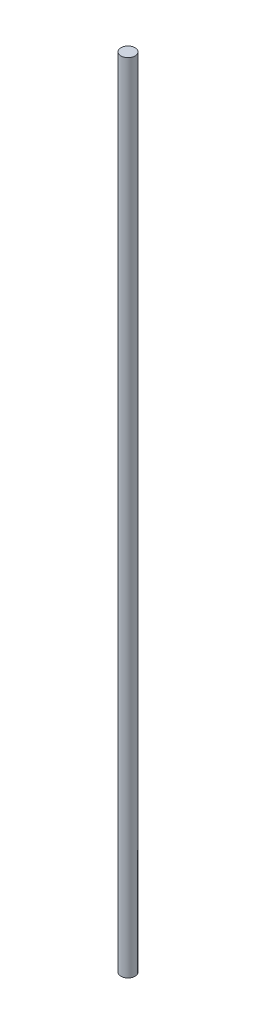
from build123d import *

# Parameters (mm, degrees)
SKETCH1_R           = 3.175
BOSS_EXTRUDE1_DEPTH = 355.6


with BuildPart() as part:
    # Sketch1 → Boss-Extrude1 (new body)
    with BuildSketch(Plane(origin=(0, 0, 0), x_dir=(1, 0, 0), z_dir=(0, 1, 0))):
        Circle(SKETCH1_R)
    extrude(amount=BOSS_EXTRUDE1_DEPTH)


solid = part.part
